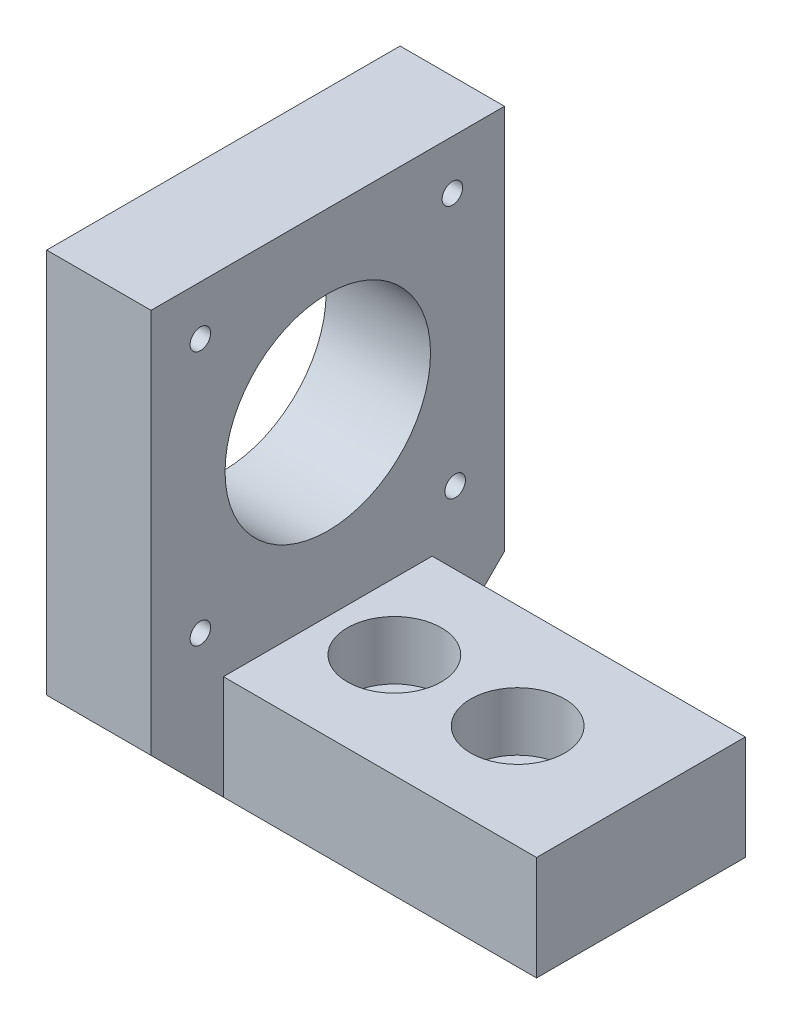
from build123d import *

# Parameters (mm, degrees)
SKETCH1_W                   = 50.8
SKETCH1_H                   = 25.4
BOSS_EXTRUDE1_DEPTH         = 12.7
SKETCH2_W                   = 43
SKETCH2_H                   = 43
SKETCH2_R                   = 12.5
BOSS_EXTRUDE2_DEPTH         = 12.7
CHAMFER1_SIZE               = 12.7
TAP_DRILL_FOR_M3X0_5_TAP1_D = 2.5
F_1_4_CLEARANCE_HOLE1_D     = 6.7564
SKETCH8_R                   = 5.715
CUT_EXTRUDE1_DEPTH          = 7.112


with BuildPart() as part:
    # Sketch1 → Boss-Extrude1 (new body)
    with BuildSketch(Plane(origin=(0, 0, 0), x_dir=(1, 0, 0), z_dir=(0, 1, 0))):
        Rectangle(SKETCH1_W, SKETCH1_H)
    extrude(amount=BOSS_EXTRUDE1_DEPTH)

    # Sketch2 → Boss-Extrude2 (add)
    with BuildSketch(Plane.ZY.offset(25.4)):
        with Locations((0, 34.2)):
            Rectangle(SKETCH2_W, SKETCH2_H)
        with Locations((0, 34.2)):
            Circle(SKETCH2_R, mode=Mode.SUBTRACT)
    extrude(amount=-BOSS_EXTRUDE2_DEPTH)

    # Chamfer1
    # the kernel refuses this chamfer: 12.7 mm, written as the material it adds along each edge
    with BuildSketch(Plane(origin=(-25.4, 12.7, 12.7), x_dir=(0, -0.9996219169112966, -0.027495876610586334), z_dir=(1, 0, 0))) as chamfer1_piece_1_section:
        Polygon((CHAMFER1_SIZE * 0.999621916911, -CHAMFER1_SIZE * 0.0274958766106), (-CHAMFER1_SIZE * 0.0274958766106, -CHAMFER1_SIZE * 0.999621916911), (0, 0), align=None)
    chamfer1_piece_1 = extrude(amount=12.7, mode=Mode.PRIVATE)
    chamfer1_piece_1 = split(chamfer1_piece_1, bisect_by=Plane(origin=(-19.05, 8.16124498, 21.5), z_dir=(0, 0, -1)), keep=Keep.TOP, mode=Mode.PRIVATE)
    add(chamfer1_piece_1)
    with BuildSketch(Plane(origin=(-12.7, 12.7, -12.7), x_dir=(0, -0.9996219169112966, 0.027495876610586334), z_dir=(-1, 0, 0))) as chamfer1_piece_2_section:
        Polygon((CHAMFER1_SIZE * 0.999621916911, -CHAMFER1_SIZE * 0.0274958766106), (-CHAMFER1_SIZE * 0.0274958766106, -CHAMFER1_SIZE * 0.999621916911), (0, 0), align=None)
    chamfer1_piece_2 = extrude(amount=12.7, mode=Mode.PRIVATE)
    chamfer1_piece_2 = split(chamfer1_piece_2, bisect_by=Plane(origin=(-19.05, 8.16124498, -21.5), z_dir=(0, 0, 1)), keep=Keep.TOP, mode=Mode.PRIVATE)
    add(chamfer1_piece_2)

    # Tap Drill for M3x0.5 Tap1 (through all)
    with Locations(Plane.ZY.offset(25.4)):
        with Locations((-15.160825054, 49.7), (15.5, 49.7), (15.5, 18.7), (-15.5, 18.7)):
            Hole(TAP_DRILL_FOR_M3X0_5_TAP1_D / 2)

    # 1/4 Clearance Hole1 (through all)
    with Locations(Plane(origin=(0, 12.7, 0), x_dir=(1, 0, 0), z_dir=(0, 1, 0))):
        with Locations((-4.6, 0), (10.4, 0)):
            Hole(F_1_4_CLEARANCE_HOLE1_D / 2)

    # Sketch8 → Cut-Extrude1 (cut)
    with BuildSketch(Plane(origin=(0, 12.7, 0), x_dir=(1, 0, 0), z_dir=(0, 1, 0))):
        with Locations(Location((-4.6, 0, 0), (0, 0, 270))):
            Circle(SKETCH8_R)
        with Locations(Location((10.4, 0, 0), (0, 0, 270))):
            Circle(SKETCH8_R)
    extrude(amount=-CUT_EXTRUDE1_DEPTH, mode=Mode.SUBTRACT)


solid = part.part
